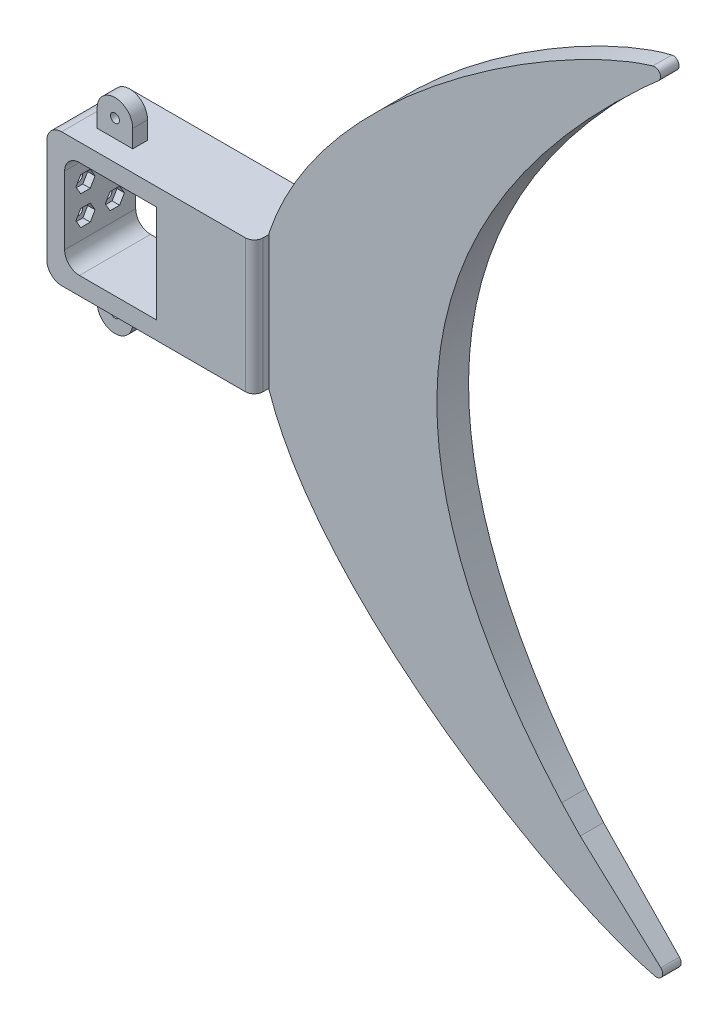
from build123d import *

# Parameters (mm, degrees)
SKETCH_1_W                      = 60
SKETCH_1_H                      = 33
EXTRUDE_1_DEPTH                 = 20
EXTRUDE_2_DEPTH                 = 2
EXTRUDE_2_DEPTH_BACK            = 22
SKETCH_2_W                      = 70
SKETCH_2_H                      = 45
SKETCH_2_W_2                    = 60
SKETCH_2_H_2                    = 33
FILLET_1_R                      = 5
FILLET_3_R                      = 5
SKETCH_4_R                      = 1.5
CUT_EXTRUDE_1_DEPTH             = 6
EXTRUDE_3_DEPTH                 = 5
SKETCH_10_R                     = 1.5
CUT_EXTRUDE_2_DEPTH             = 10
CUT_EXTRUDE_3_REACH             = 226.939
SKETCH_11_W                     = 18.282692537
SKETCH_11_H                     = 434.171944943
CUT_EXTRUDE_3_DIRECTION_2_DEPTH = 50
EXTRUDE_5_DEPTH                 = 14
CUT_EXTRUDE_7_DEPTH             = 303
FILLET_13_R                     = 2
CUT_EXTRUDE_9_DEPTH             = 2
SKETCH_26_W                     = 29.045801072
SKETCH_26_H                     = 33
EXTRUDE_6_DEPTH                 = 3
CUT_EXTRUDE_10_DEPTH            = 2.5
SKETCH_28_W                     = 29.045801072
SKETCH_28_H                     = 33
EXTRUDE_7_DEPTH                 = 3
SKETCH_29_W                     = 24
SKETCH_29_H                     = 33
EXTRUDE_9_DEPTH                 = 3
SKETCH_31_W                     = 1.99310748
SKETCH_31_H                     = 0.511561055
CUT_EXTRUDE_12_DEPTH            = 23
FILLET_START                    = 2
FILLET_15_DEPTH                 = 16
FILLET_16_DEPTH                 = 16
FILLET_17_R                     = 3
FILLET_18_R                     = 3


with BuildPart() as part:
    # 草图1 → 凸台-拉伸1 (new body)
    with BuildSketch(Plane.XY):
        with BuildLine():
            Line((0, 45), (70, 45))
            Line((70, 45), (202.961822291, 156.568216045))
            add(Edge.make_bspline(
                [(202.961822291, 156.568216045), (47.038177709, 22.5), (202.961822291, -111.568216045)],
                knots=[0, 0, 0, 1, 1, 1], degree=2))
            Line((202.961822291, -111.568216045), (70, 0))
            Line((70, 0), (0, 0))
            Line((0, 0), (0, 45))
        make_face()
        with Locations((36, 22.5)):
            Rectangle(SKETCH_1_W, SKETCH_1_H, mode=Mode.SUBTRACT)
    extrude(amount=EXTRUDE_1_DEPTH)

    # 草图2 → 凸台-拉伸2 (add, two sides: drawn at the far end of the back side and taken through both)
    with BuildSketch(Plane.XY.offset(20).offset(-EXTRUDE_2_DEPTH_BACK)):
        with Locations((35, 22.5)):
            Rectangle(SKETCH_2_W, SKETCH_2_H)
        with Locations((36, 22.5)):
            Rectangle(SKETCH_2_W_2, SKETCH_2_H_2, mode=Mode.SUBTRACT)
    extrude(amount=EXTRUDE_2_DEPTH + EXTRUDE_2_DEPTH_BACK)

    # 圆角1
    fillet_1_edges = [part.edges().sort_by_distance(p)[0] for p in [
        (0, 45, 10),
        (70, 45, 10),
        (70, 0, 10),
        (0, 0, 10),
    ]]
    fillet(fillet_1_edges, radius=FILLET_1_R)

    # 圆角3
    fillet_3_edges = [part.edges().sort_by_distance(p)[0] for p in [
        (6, 39, 10),
        (6, 6, 10),
    ]]
    fillet(fillet_3_edges, radius=FILLET_3_R)

    # 草图4 → 切除-拉伸1 (cut)
    with BuildSketch(Plane.ZY):
        with Locations(Location((5.050252532, 27.449747468, 0), (0, 0, 270))):
            Circle(SKETCH_4_R)
        with Locations(Location((14.949747468, 27.449747468, 0), (0, 0, 270))):
            Circle(SKETCH_4_R)
        with Locations(Location((14.949747468, 17.550252532, 0), (0, 0, 270))):
            Circle(SKETCH_4_R)
        with Locations(Location((5.050252532, 17.550252532, 0), (0, 0, 270))):
            Circle(SKETCH_4_R)
    extrude(amount=-CUT_EXTRUDE_1_DEPTH, mode=Mode.SUBTRACT)

    # 草图9 → 凸台-拉伸3 (add)
    with BuildSketch(Plane.XY.offset(10)):
        with BuildLine():
            Line((10, 45), (10, 51))
            ThreePointArc((10, 51), (16, 57), (22, 51))
            Line((22, 51), (22, 45))
            Line((22, 45), (10, 45))
        make_face()
    extrude_3 = extrude(amount=EXTRUDE_3_DEPTH)

    # 草图10 → 切除-拉伸2 (cut)
    with BuildSketch(Plane.XY.offset(15)):
        with Locations((16, 51)):
            Circle(SKETCH_10_R)
    cut_extrude_2 = extrude(amount=-CUT_EXTRUDE_2_DEPTH, mode=Mode.SUBTRACT)

    # 镜向1: 凸台-拉伸3, 切除-拉伸2 across plane
    add(extrude_3.mirror(Plane(origin=(0, 22.5, 0), x_dir=(0, 0, 1), z_dir=(0, -1, 0))))
    add(cut_extrude_2.mirror(Plane(origin=(0, 22.5, 0), x_dir=(0, 0, 1), z_dir=(0, -1, 0))), mode=Mode.SUBTRACT)

    # 切除-拉伸3: up to this face of the body (flat: up to its plane)
    cut_extrude_3_end = Plane(part.part.faces().sort_by_distance((70, 22.5, -1))[0])
    # 草图11 → 切除-拉伸3 (cut, up to the picked face)
    with BuildSketch(Plane(origin=(160, 0, 0), x_dir=(0, 0, -1), z_dir=(1, 0, 0)), mode=Mode.PRIVATE) as cut_extrude_3_sk1:
        with Locations((-26.141346269, 5.50221692)):
            Rectangle(SKETCH_11_W, SKETCH_11_H)
    cut_extrude_3_tool1 = split(extrude(cut_extrude_3_sk1.sketch, amount=-CUT_EXTRUDE_3_REACH, mode=Mode.PRIVATE), bisect_by=cut_extrude_3_end, keep=Keep.BOTH, mode=Mode.PRIVATE)
    # 草图11 → 切除-拉伸3 (cut, up to the picked face)
    with BuildSketch(Plane(origin=(160, 0, 0), x_dir=(0, 0, -1), z_dir=(1, 0, 0)), mode=Mode.PRIVATE) as cut_extrude_3_sk2:
        with Locations((6.141346269, 5.50221692)):
            Rectangle(SKETCH_11_W, SKETCH_11_H)
    cut_extrude_3_tool2 = split(extrude(cut_extrude_3_sk2.sketch, amount=-CUT_EXTRUDE_3_REACH, mode=Mode.PRIVATE), bisect_by=cut_extrude_3_end, keep=Keep.BOTH, mode=Mode.PRIVATE)
    add(cut_extrude_3_tool1.solids().sort_by(Axis((160, 5.502217, 26.141346), (-1, 0, 0)))[0], mode=Mode.SUBTRACT)
    add(cut_extrude_3_tool2.solids().sort_by(Axis((160, 5.502217, -6.141346), (-1, 0, 0)))[0], mode=Mode.SUBTRACT)

    # 草图11 → 切除-拉伸3 direction 2 (cut)
    with BuildSketch(Plane(origin=(160, 0, 0), x_dir=(0, 0, -1), z_dir=(1, 0, 0))):
        with Locations((-26.141346269, 5.50221692)):
            Rectangle(SKETCH_11_W, SKETCH_11_H)
        with Locations((6.141346269, 5.50221692)):
            Rectangle(SKETCH_11_W, SKETCH_11_H)
    extrude(amount=CUT_EXTRUDE_3_DIRECTION_2_DEPTH, mode=Mode.SUBTRACT)

    # 草图15 → 凸台-拉伸5 (add)
    with BuildSketch(Plane.XY.offset(17)):
        with BuildLine():
            Line((202.961822291, 156.568216045), (147.579421732, 107.219746152))
            Line((147.579421732, 107.219746152), (107.818203445, 22.5))
            Line((107.818203445, 22.5), (124.24412663, -22.980020299))
            Line((124.24412663, -22.980020299), (142.109136261, -47.906876261))
            Line((142.109136261, -47.906876261), (171.972637601, -81.421844341))
            Line((171.972637601, -81.421844341), (202.961822291, -111.568216045))
            add(Edge.make_bspline(
                [(202.961822291, 156.568216045), (177.452887624, 154.767081982), (65.429889591, 90.139155596), (64.927030958, -45.08824902), (180.474155987, -110.917536011), (202.961822291, -111.568216045)],
                knots=[0, 0, 0, 0, 0.442633093, 0.557366907, 1, 1, 1, 1], degree=3))
        make_face()
    extrude(amount=-EXTRUDE_5_DEPTH)

    # 草图20 → 切除-拉伸7 (cut)
    with BuildSketch(Plane(origin=(0, 170, 0), x_dir=(1, 0, 0), z_dir=(0, 1, 0))):
        Polygon((202.961822291, -13), (202.961822291, -17), (70, -17), align=None)
        Polygon((202.961822291, -7), (202.961822291, -3), (70, -3), align=None)
    extrude(amount=-CUT_EXTRUDE_7_DEPTH, mode=Mode.SUBTRACT)

    # 圆角13
    fillet_13_edges = [part.edges().sort_by_distance(p)[0] for p in [
        (202.961822291, -111.568216045, 10),
        (202.961822291, 156.568216045, 10),
    ]]
    fillet(fillet_13_edges, radius=FILLET_13_R)

    # 草图24 → 切除-拉伸9 (cut)
    with BuildSketch(Plane.XY.offset(10)):
        with BuildLine():
            add(Edge.make_bspline(
                [(102.088253061, -30.81275872), (94.097110121, -23.855206276), (80.677618502, -9.672273898), (80.496724867, 22.412735423), (83.068617082, 51.53571739), (94.17074493, 68.542440378), (119.016062774, 83.084637645), (116.087395545, 49.758722123), (111.460008898, 23.867512823), (113.602042043, -5.563812297), (134.491858823, -56.667502825), (110.140420406, -37.823442551), (102.088253061, -30.81275872)],
                knots=[0, 0, 0, 0, 0.093878297, 0.231319402, 0.316224374, 0.404134193, 0.46290813, 0.539833526, 0.644851605, 0.783425212, 0.905404801, 1, 1, 1, 1], degree=3))
        make_face()
    cut_extrude_9 = extrude(amount=CUT_EXTRUDE_9_DEPTH, mode=Mode.SUBTRACT)

    # 镜向2: 切除-拉伸9 across plane
    add(cut_extrude_9.mirror(Plane.XY.offset(10)), mode=Mode.SUBTRACT)

    # 草图26 → 凸台-拉伸6 (add)
    with BuildSketch(Plane(origin=(0, 0, -2), x_dir=(-1, 0, 0), z_dir=(0, 0, -1))):
        with Locations((-51.477099464, 22.5)):
            Rectangle(SKETCH_26_W, SKETCH_26_H)
    extrude(amount=-EXTRUDE_6_DEPTH)

    # 草图27 → 切除-拉伸10 (cut)
    with BuildSketch(Plane(origin=(6, 0, 0), x_dir=(0, 0, -1), z_dir=(1, 0, 0))):
        Polygon((-11.716585961, 27.449747468), (-13.333166715, 30.249747468), (-16.566328222, 30.249747468), (-18.182908976, 27.449747468), (-16.566328222, 24.649747468), (-13.333166715, 24.649747468), align=None)
        Polygon((-1.817091024, 27.449747468), (-3.433671778, 30.249747468), (-6.666833285, 30.249747468), (-8.283414039, 27.449747468), (-6.666833285, 24.649747468), (-3.433671778, 24.649747468), align=None)
        Polygon((-11.716585961, 17.550252532), (-13.333166715, 20.350252532), (-16.566328222, 20.350252532), (-18.182908976, 17.550252532), (-16.566328222, 14.750252532), (-13.333166715, 14.750252532), align=None)
        Polygon((-1.817091024, 17.550252532), (-3.433671778, 20.350252532), (-6.666833285, 20.350252532), (-8.283414039, 17.550252532), (-6.666833285, 14.750252532), (-3.433671778, 14.750252532), align=None)
    extrude(amount=-CUT_EXTRUDE_10_DEPTH, mode=Mode.SUBTRACT)



with BuildPart() as body_2:
    # 草图28 → 凸台-拉伸7 (new body)
    with BuildSketch(Plane.XY.offset(22)):
        with Locations((51.477099464, 22.5)):
            Rectangle(SKETCH_28_W, SKETCH_28_H)
    extrude(amount=-EXTRUDE_7_DEPTH)


with BuildPart() as part_1:
    add(part.part)

    add(body_2.part)  # 凸台-拉伸9 merges body 2
    # 草图29 → 凸台-拉伸9 (add)
    with BuildSketch(Plane.ZY.offset(-36.954198928)):
        with Locations((10, 22.5)):
            Rectangle(SKETCH_29_W, SKETCH_29_H)
    extrude(amount=-EXTRUDE_9_DEPTH)

    # 草图31 → 切除-拉伸12 (cut)
    with BuildSketch(Plane.XY.offset(20)):
        with Locations((69.00344626, 45.255780528)):
            Rectangle(SKETCH_31_W, SKETCH_31_H)
        with Locations((69.00344626, -0.255780528)):
            Rectangle(SKETCH_31_W, SKETCH_31_H)
    extrude(amount=-CUT_EXTRUDE_12_DEPTH, mode=Mode.SUBTRACT)

    # 圆角15: read off the stored shape, not the designer's step
    # 圆角15 outline → 圆角15 (cut)
    with BuildSketch(Plane.XY.offset(FILLET_START)):
        with BuildLine():
            ThreePointArc((70, 45), (70.045230689, 45.399441364), (70.143459392, 45.789249445))
            add(Edge.make_bspline(
                [(70.143459392, 45.789249445), (70.095178766, 45.640526925), (70.047358218, 45.491759238), (70, 45.3429471)],
                knots=[0.441499369, 0.441499369, 0.441499369, 0.441499369, 0.442633093, 0.442633093, 0.442633093, 0.442633093], degree=3))
            Line((70, 45.3429471), (70, 45))
        make_face()
    extrude(amount=FILLET_15_DEPTH, mode=Mode.SUBTRACT)

    # 圆角16: read off the stored shape, not the designer's step
    # 圆角16 outline → 圆角16 (cut)
    with BuildSketch(Plane.XY.offset(FILLET_START)):
        with BuildLine():
            ThreePointArc((70.145731335, -0.792333552), (70.046147909, -0.401080886), (70, 0))
            Line((70, 0), (70, -0.3429471))
            add(Edge.make_bspline(
                [(70, -0.3429471), (70.048095342, -0.492782597), (70.096673259, -0.642578339), (70.145731335, -0.792333552)],
                knots=[0.557366907, 0.557366907, 0.557366907, 0.557366907, 0.558504581, 0.558504581, 0.558504581, 0.558504581], degree=3))
        make_face()
    extrude(amount=FILLET_16_DEPTH, mode=Mode.SUBTRACT)

    # 圆角17
    fillet_17_edges = [part_1.edges().sort_by_distance(p)[0] for p in [
        (70, 22.5, -2),
    ]]
    fillet(fillet_17_edges, radius=FILLET_17_R)

    # 圆角18
    fillet_18_edges = [part_1.edges().sort_by_distance(p)[0] for p in [
        (70, 22.5, 22),
    ]]
    fillet(fillet_18_edges, radius=FILLET_18_R)


solid = part_1.part
